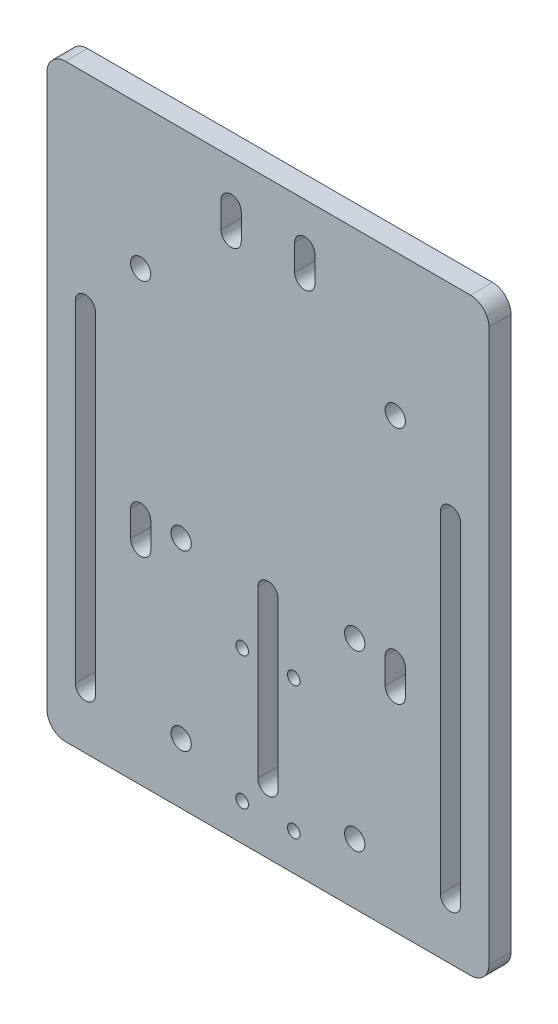
from build123d import *

# Parameters (mm, degrees)
BOSS_EXTRUDE1_DEPTH      = 6
CUT_EXTRUDE1_DEPTH       = 6
M5_CLEARANCE_HOLE1_D     = 5.5
CUT_EXTRUDE2_DEPTH       = 22
M5_CLEARANCE_HOLE2_D     = 5.5
CUT_EXTRUDE3_DEPTH       = 6
CUT_EXTRUDE4_DEPTH       = 6
M3_CLEARANCE_HOLE1_D     = 3.4
M3_CLEARANCE_HOLE1_DEPTH = 10
M3_CLEARANCE_HOLE1_TIP   = 1.021463052


with BuildPart() as part:
    # Sketch2 → Boss-Extrude1 (new body)
    with BuildSketch(Plane.XY):
        with BuildLine():
            Line((-55, -80), (55, -80))
            ThreePointArc((55, -80), (58.535533906, -78.535533906), (60, -75))
            Line((60, -75), (60, 75))
            ThreePointArc((60, 75), (58.535533906, 78.535533906), (55, 80))
            Line((55, 80), (-55, 80))
            ThreePointArc((-55, 80), (-58.535533906, 78.535533906), (-60, 75))
            Line((-60, 75), (-60, -75))
            ThreePointArc((-60, -75), (-58.535533906, -78.535533906), (-55, -80))
        make_face()
    extrude(amount=BOSS_EXTRUDE1_DEPTH)

    # Sketch3 → Cut-Extrude1 (cut)
    with BuildSketch(Plane.XY.offset(6)):
        with BuildLine():
            Line((2.75, -17.5), (2.75, -62.5))
            ThreePointArc((2.75, -62.5), (0, -65.25), (-2.75, -62.5))
            Line((-2.75, -62.5), (-2.75, -17.5))
            ThreePointArc((-2.75, -17.5), (0, -14.75), (2.75, -17.5))
        make_face()
    extrude(amount=-CUT_EXTRUDE1_DEPTH, mode=Mode.SUBTRACT)

    # M5 Clearance Hole1 (through all)
    with Locations(Plane.XY.offset(6)):
        with Locations((-23.57, -63.57), (-23.57, -16.43), (23.57, -16.43), (23.57, -63.57)):
            Hole(M5_CLEARANCE_HOLE1_D / 2)

    # Sketch6 → Cut-Extrude2 (cut)
    with BuildSketch(Plane.XY.offset(6)):
        with BuildLine():
            Line((-31.82, -16.43), (-31.82, -23.43))
            ThreePointArc((-31.82, -23.43), (-34.57, -26.18), (-37.32, -23.43))
            Line((-37.32, -23.43), (-37.32, -16.43))
            ThreePointArc((-37.32, -16.43), (-34.57, -13.68), (-31.82, -16.43))
        make_face()
    cut_extrude2 = extrude(amount=-CUT_EXTRUDE2_DEPTH, mode=Mode.SUBTRACT)

    # M5 Clearance Hole2 (through all)
    with Locations(Plane.XY.offset(6)):
        with Locations((-34.57, 41.47)):
            m5_clearance_hole2 = Hole(M5_CLEARANCE_HOLE2_D / 2)

    # Sketch9 → Cut-Extrude3 (cut)
    with BuildSketch(Plane.XY.offset(6)):
        with BuildLine():
            Line((-46.82, 25.07), (-46.82, -64.93))
            ThreePointArc((-46.82, -64.93), (-49.57, -67.68), (-52.32, -64.93))
            Line((-52.32, -64.93), (-52.32, 25.07))
            ThreePointArc((-52.32, 25.07), (-49.57, 27.82), (-46.82, 25.07))
        make_face()
    cut_extrude3 = extrude(amount=-CUT_EXTRUDE3_DEPTH, mode=Mode.SUBTRACT)

    # Mirror2: Cut-Extrude2, M5 Clearance Hole2, Cut-Extrude3 across plane
    add(cut_extrude2.mirror(Plane(origin=(0, 0, 0), x_dir=(0, 0, 1), z_dir=(1, 0, 0))), mode=Mode.SUBTRACT)
    add(m5_clearance_hole2.mirror(Plane(origin=(0, 0, 0), x_dir=(0, 0, 1), z_dir=(1, 0, 0))), mode=Mode.SUBTRACT)
    add(cut_extrude3.mirror(Plane(origin=(0, 0, 0), x_dir=(0, 0, 1), z_dir=(1, 0, 0))), mode=Mode.SUBTRACT)

    # Sketch11 → Cut-Extrude4 (cut)
    with BuildSketch(Plane.XY.offset(6)):
        with BuildLine():
            Line((-7.25, 68.5), (-7.25, 61.5))
            ThreePointArc((-7.25, 61.5), (-10, 58.75), (-12.75, 61.5))
            Line((-12.75, 61.5), (-12.75, 68.5))
            ThreePointArc((-12.75, 68.5), (-10, 71.25), (-7.25, 68.5))
        make_face()
        with BuildLine():
            Line((12.75, 68.5), (12.75, 61.5))
            ThreePointArc((12.75, 61.5), (10, 58.75), (7.25, 61.5))
            Line((7.25, 61.5), (7.25, 68.5))
            ThreePointArc((7.25, 68.5), (10, 71.25), (12.75, 68.5))
        make_face()
    extrude(amount=-CUT_EXTRUDE4_DEPTH, mode=Mode.SUBTRACT)

    # M3 Clearance Hole1
    with Locations(Plane.XY.offset(6)):
        with Locations((-7, -34), (7, -34), (7, -70), (-7, -70)):
            Hole(M3_CLEARANCE_HOLE1_D / 2, depth=M3_CLEARANCE_HOLE1_DEPTH)
            with Locations((0, 0, -(M3_CLEARANCE_HOLE1_DEPTH + M3_CLEARANCE_HOLE1_TIP / 2))):  # 118° drill point
                Cone(0, M3_CLEARANCE_HOLE1_D / 2, M3_CLEARANCE_HOLE1_TIP, mode=Mode.SUBTRACT)


solid = part.part
